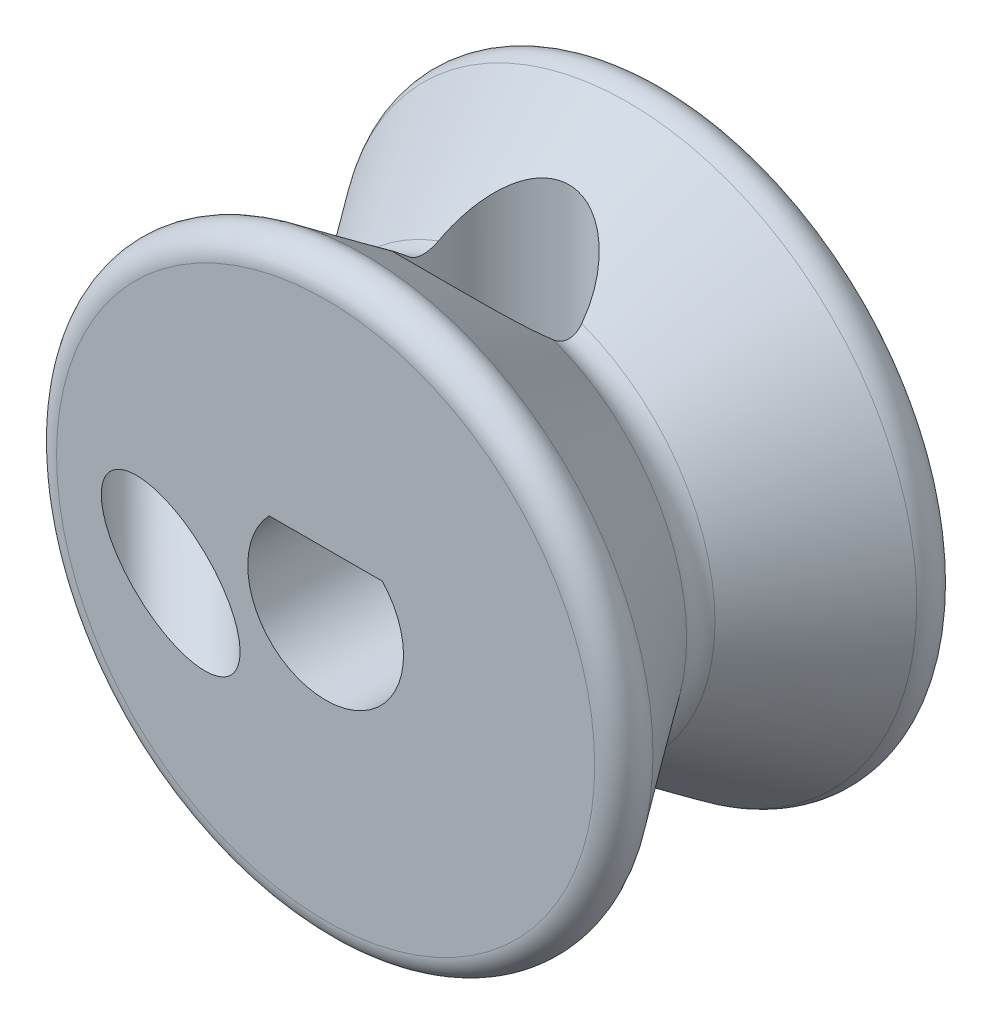
from build123d import *

# Parameters (mm, degrees)
CUT_EXTRUDE1_DEPTH      = 7
CUT_EXTRUDE2_DEPTH      = 0.5
CUT_EXTRUDE2_DEPTH_BACK = 7
SKETCH5_R               = 1.5
SKETCH6_R               = 1
CUT_EXTRUDE3_DEPTH      = 15.165183726


with BuildPart() as part:
    # Sketch3 → Revolve1 (revolve)
    with BuildSketch(Plane(origin=(0, 0, 0), x_dir=(0, 0, -1), z_dir=(1, 0, 0))):
        with BuildLine():
            Line((0, 0), (7, 0))
            Line((7, 0), (7, 5.528405338))
            ThreePointArc((7, 5.528405338), (6.72879079, 5.972989159), (6.209380903, 5.935272074))
            Line((6.209380903, 5.935272074), (3.790619097, 4.207585069))
            ThreePointArc((3.790619097, 4.207585069), (3.5, 4.114451805), (3.209380903, 4.207585069))
            Line((3.209380903, 4.207585069), (0.790619097, 5.935272074))
            ThreePointArc((0.790619097, 5.935272074), (0.27120921, 5.972989159), (0, 5.528405338))
            Line((0, 5.528405338), (0, 0))
        make_face()
    revolve(axis=Axis((0, 0, 0), (0, 0, -1)))

    # Sketch4 → Cut-Extrude1 (cut)
    with BuildSketch(Plane.XY):
        with BuildLine():
            Line((-1.161895004, 1.1), (1.161895004, 1.1))
            ThreePointArc((1.161895004, 1.1), (0, -1.6), (-1.161895004, 1.1))
        make_face()
    extrude(amount=-CUT_EXTRUDE1_DEPTH, mode=Mode.SUBTRACT)

    # Sketch5 → Cut-Extrude2 (cut, two sides: drawn at the far end of the back side and taken through both)
    with BuildSketch(Plane.XZ.offset(-1.1).offset(-CUT_EXTRUDE2_DEPTH_BACK)):
        with Locations((0, -3.5)):
            Circle(SKETCH5_R)
    extrude(amount=CUT_EXTRUDE2_DEPTH + CUT_EXTRUDE2_DEPTH_BACK, mode=Mode.SUBTRACT)

    # Sketch6 → Cut-Extrude3 (cut, through all)
    with BuildSketch(Plane(origin=(-3.518068909, 3.330658784, -2.317567568), x_dir=(-0.42208609583507634, 0.3996012581818788, 0.8137334712067351), z_dir=(-0.590920534169107, 0.5594417614546305, -0.5812381937190964))):
        with Locations((0.041685972, -2.865176302)):
            Circle(SKETCH6_R)
    extrude(amount=-CUT_EXTRUDE3_DEPTH, mode=Mode.SUBTRACT)


solid = part.part
